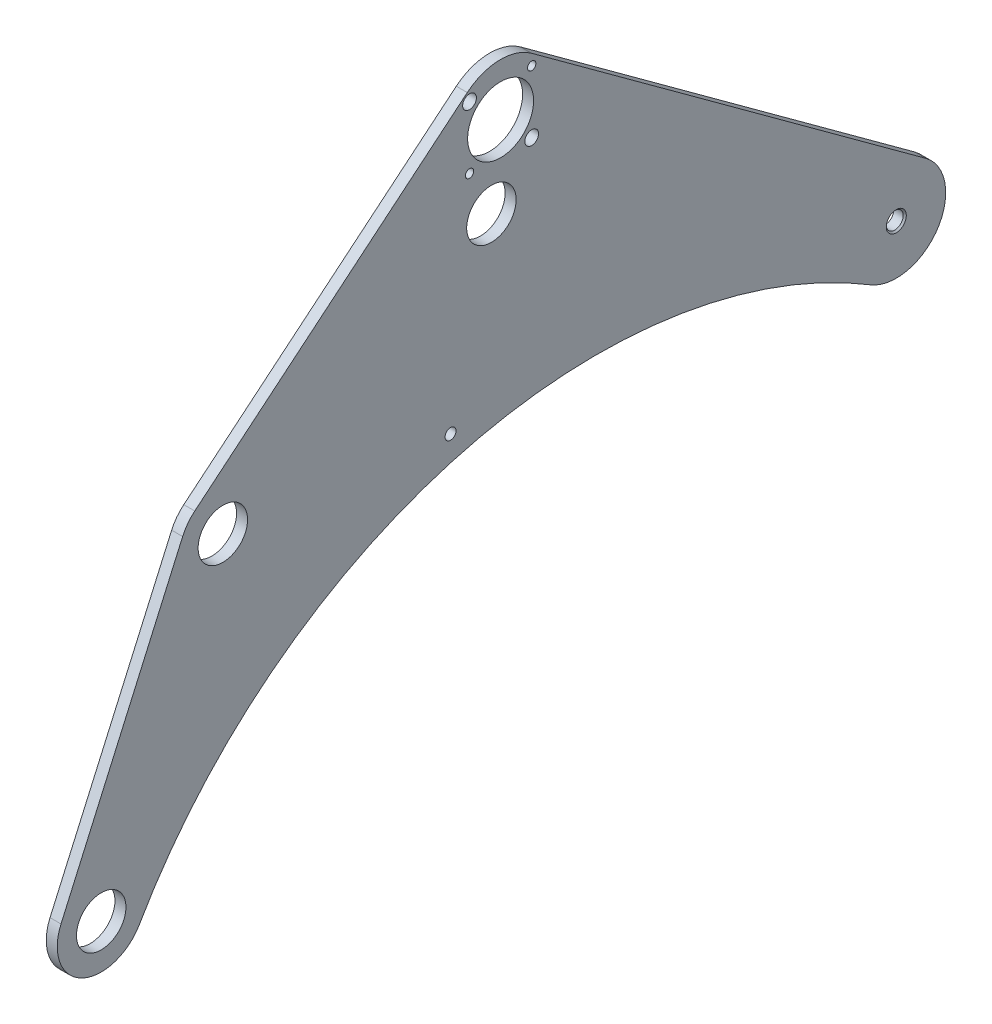
from build123d import *

# Parameters (mm, degrees)
BOSS_EXTRUDE1_DEPTH               = 6.35
CUT_EXTRUDE1_REACH                = 524.664
SKETCH3_R                         = 14.2875
SKETCH3_R_2                       = 19.05
SKETCH3_R_3                       = 2.413
SKETCH3_R_4                       = 3.96875
F_3_8_CLEARANCE_HOLE2_D           = 9.8044
F_3_8_CLEARANCE_HOLE2_CSINK_D     = 11.58748
F_3_8_CLEARANCE_HOLE2_CSINK_ANGLE = 90
F_1_4_0_25_DIAMETER_HOLE1_D       = 6.35


with BuildPart() as part:
    # Sketch2 → Boss-Extrude1 (new body)
    with BuildSketch(Plane(origin=(0, 0, 0), x_dir=(0, 0, -1), z_dir=(1, 0, 0))):
        with BuildLine():
            Line((-482.60379809, -110.367631362), (-412.322756293, 48.382368638))
            ThreePointArc((-412.322756293, 48.382368638), (-409.356755671, 53.420078169), (-405.317550321, 57.646246309))
            Line((-405.317550321, 57.646246309), (-247.861830388, 188.311167492))
            ThreePointArc((-247.861830388, 188.311167492), (-229.528335431, 195.248210554), (-210.802762557, 189.452304729))
            Line((-210.802762557, 189.452304729), (16.860540736, 23.07060448))
            ThreePointArc((16.860540736, 23.07060448), (23.77080172, -15.85810867), (-14.82663888, -24.427472332))
            ThreePointArc((-14.82663888, -24.427472332), (-249.026478812, 10.173094114), (-437.347284158, -133.291321323))
            ThreePointArc((-437.347284158, -133.291321323), (-470.855508227, -143.308975656), (-482.60379809, -110.367631362))
        make_face()
    extrude(amount=BOSS_EXTRUDE1_DEPTH)

    # Sketch3 → Cut-Extrude1 (cut, up to next)
    with BuildSketch(Plane(origin=(6.35, 0, 0), x_dir=(0, 0, -1), z_dir=(1, 0, 0)), mode=Mode.PRIVATE) as cut_extrude1_sk1:
        with Locations((-233.920974527, 120.65)):
            Circle(SKETCH3_R)
    cut_extrude1_tool1 = extrude(cut_extrude1_sk1.sketch, amount=-CUT_EXTRUDE1_REACH, mode=Mode.PRIVATE) & part.part
    # Sketch3 → Cut-Extrude1 (cut, up to next)
    with BuildSketch(Plane(origin=(6.35, 0, 0), x_dir=(0, 0, -1), z_dir=(1, 0, 0)), mode=Mode.PRIVATE) as cut_extrude1_sk2:
        with Locations((-389.097061574, 38.1)):
            Circle(SKETCH3_R)
    cut_extrude1_tool2 = extrude(cut_extrude1_sk2.sketch, amount=-CUT_EXTRUDE1_REACH, mode=Mode.PRIVATE) & part.part
    # Sketch3 → Cut-Extrude1 (cut, up to next)
    with BuildSketch(Plane(origin=(6.35, 0, 0), x_dir=(0, 0, -1), z_dir=(1, 0, 0)), mode=Mode.PRIVATE) as cut_extrude1_sk3:
        with Locations((-459.378103371, -120.65)):
            Circle(SKETCH3_R)
    cut_extrude1_tool3 = extrude(cut_extrude1_sk3.sketch, amount=-CUT_EXTRUDE1_REACH, mode=Mode.PRIVATE) & part.part
    # Sketch3 → Cut-Extrude1 (cut, up to next)
    with BuildSketch(Plane(origin=(6.35, 0, 0), x_dir=(0, 0, -1), z_dir=(1, 0, 0)), mode=Mode.PRIVATE) as cut_extrude1_sk4:
        with Locations((-228.6, 165.1)):
            Circle(SKETCH3_R_2)
    cut_extrude1_tool4 = extrude(cut_extrude1_sk4.sketch, amount=-CUT_EXTRUDE1_REACH, mode=Mode.PRIVATE) & part.part
    # Sketch3 → Cut-Extrude1 (cut, up to next)
    with BuildSketch(Plane(origin=(6.35, 0, 0), x_dir=(0, 0, -1), z_dir=(1, 0, 0)), mode=Mode.PRIVATE) as cut_extrude1_sk5:
        with Locations((-246.560512242, 147.139487758)):
            Circle(SKETCH3_R_3)
    cut_extrude1_tool5 = extrude(cut_extrude1_sk5.sketch, amount=-CUT_EXTRUDE1_REACH, mode=Mode.PRIVATE) & part.part
    # Sketch3 → Cut-Extrude1 (cut, up to next)
    with BuildSketch(Plane(origin=(6.35, 0, 0), x_dir=(0, 0, -1), z_dir=(1, 0, 0)), mode=Mode.PRIVATE) as cut_extrude1_sk6:
        with Locations((-210.639487758, 147.139487758)):
            Circle(SKETCH3_R_4)
    cut_extrude1_tool6 = extrude(cut_extrude1_sk6.sketch, amount=-CUT_EXTRUDE1_REACH, mode=Mode.PRIVATE) & part.part
    # Sketch3 → Cut-Extrude1 (cut, up to next)
    with BuildSketch(Plane(origin=(6.35, 0, 0), x_dir=(0, 0, -1), z_dir=(1, 0, 0)), mode=Mode.PRIVATE) as cut_extrude1_sk7:
        with Locations((-210.639487758, 183.060512242)):
            Circle(SKETCH3_R_3)
    cut_extrude1_tool7 = extrude(cut_extrude1_sk7.sketch, amount=-CUT_EXTRUDE1_REACH, mode=Mode.PRIVATE) & part.part
    # Sketch3 → Cut-Extrude1 (cut, up to next)
    with BuildSketch(Plane(origin=(6.35, 0, 0), x_dir=(0, 0, -1), z_dir=(1, 0, 0)), mode=Mode.PRIVATE) as cut_extrude1_sk8:
        with Locations((-246.560512242, 183.060512242)):
            Circle(SKETCH3_R_4)
    cut_extrude1_tool8 = extrude(cut_extrude1_sk8.sketch, amount=-CUT_EXTRUDE1_REACH, mode=Mode.PRIVATE) & part.part
    add(cut_extrude1_tool1.solids().sort_by_distance((6.35, 120.65, 233.920975))[0], mode=Mode.SUBTRACT)
    add(cut_extrude1_tool2.solids().sort_by_distance((6.35, 38.1, 389.097062))[0], mode=Mode.SUBTRACT)
    add(cut_extrude1_tool3.solids().sort_by_distance((6.35, -120.65, 459.378103))[0], mode=Mode.SUBTRACT)
    add(cut_extrude1_tool4.solids().sort_by_distance((6.35, 165.1, 228.6))[0], mode=Mode.SUBTRACT)
    add(cut_extrude1_tool5.solids().sort_by_distance((6.35, 147.139488, 246.560512))[0], mode=Mode.SUBTRACT)
    add(cut_extrude1_tool6.solids().sort_by_distance((6.35, 147.139488, 210.639488))[0], mode=Mode.SUBTRACT)
    add(cut_extrude1_tool7.solids().sort_by_distance((6.35, 183.060512, 210.639488))[0], mode=Mode.SUBTRACT)
    add(cut_extrude1_tool8.solids().sort_by_distance((6.35, 183.060512, 246.560512))[0], mode=Mode.SUBTRACT)

    # 3/8 Clearance Hole2 (through all)
    with Locations(Plane(origin=(6.35, 0, 0), x_dir=(0, 0, -1), z_dir=(1, 0, 0))):
        with Locations((0, 0)):
            CounterSinkHole(F_3_8_CLEARANCE_HOLE2_D / 2, F_3_8_CLEARANCE_HOLE2_CSINK_D / 2, counter_sink_angle=F_3_8_CLEARANCE_HOLE2_CSINK_ANGLE)

    # 1/4 (0.25) Diameter Hole1 (through all)
    with Locations(Plane(origin=(6.35, 0, 0), x_dir=(0, 0, -1), z_dir=(1, 0, 0))):
        with Locations((-257.525061574, 22.352)):
            Hole(F_1_4_0_25_DIAMETER_HOLE1_D / 2)


solid = part.part
